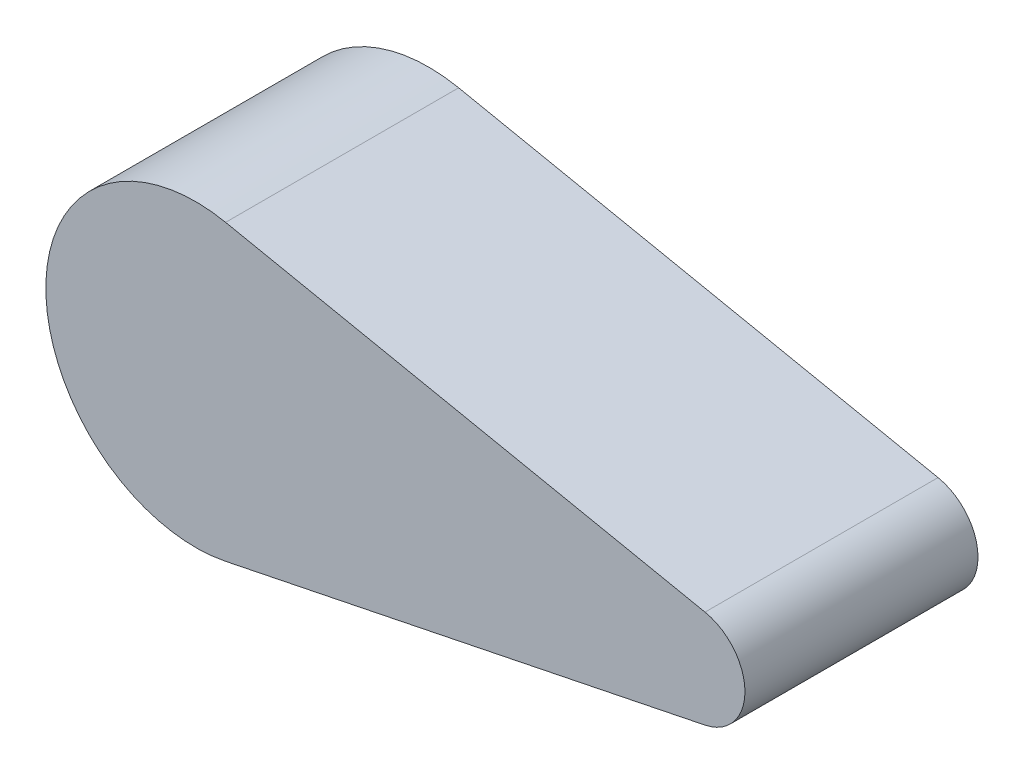
from build123d import *

# Parameters (mm, degrees)
BOSS_EXTRUDE1_DEPTH = 7
CUT_EXTRUDE1_DEPTH  = 5


with BuildPart() as part:
    # Sketch1 → Boss-Extrude1 (new body)
    with BuildSketch(Plane.XY):
        with BuildLine():
            Line((0.9, 4.409081537), (15.3, 1.469693846))
            ThreePointArc((15.3, 1.469693846), (16.5, 0), (15.3, -1.469693846))
            Line((15.3, -1.469693846), (0.9, -4.409081537))
            ThreePointArc((0.9, -4.409081537), (-4.5, 0), (0.9, 4.409081537))
        make_face()
    extrude(amount=BOSS_EXTRUDE1_DEPTH)

    # Sketch2 → Cut-Extrude1 (cut)
    with BuildSketch(Plane(origin=(0, 0, 0), x_dir=(-1, 0, 0), z_dir=(0, 0, -1))):
        with BuildLine():
            Line((0.323621049, -2.33034215), (0.285861652, -2.067133858))
            ThreePointArc((0.285861652, -2.067133858), (0.324400737, -1.894344075), (0.46770846, -1.790400808))
            add(Edge.make_bspline(
                [(0.46770846, -1.790400808), (0.507644834, -1.7795375), (0.54705519, -1.766898324)],
                knots=[1.762455787, 1.762455787, 1.762455787, 1.807210933, 1.807210933, 1.807210933], degree=2, weights=[1, 0.999749633, 1]))
            ThreePointArc((0.54705519, -1.766898324), (0.723856125, -1.776023385), (0.850282514, -1.899952525))
            Line((0.850282514, -1.899952525), (0.96196408, -2.141265087))
            add(Edge.make_bspline(
                [(0.96196408, -2.141265087), (0.965953537, -2.149885186), (0.971559773, -2.159792231), (0.982538977, -2.175431153), (0.999087228, -2.196781931), (1.018575452, -2.220978079), (1.038535601, -2.242722272), (1.065318491, -2.26943702), (1.093278731, -2.295479762), (1.122830329, -2.32056638), (1.163402531, -2.352492636), (1.211319166, -2.386601982), (1.265237405, -2.421286276), (1.34272265, -2.465791027), (1.417102533, -2.502156085), (1.477952577, -2.528307077), (1.525444105, -2.546734242), (1.558445397, -2.558649631)],
                knots=[0, 0, 0, 0, 0, 0, 0.071428571, 0.085714286, 0.142857143, 0.2, 0.228571429, 0.285714286, 0.357142857, 0.414285714, 0.471428571, 0.585714286, 0.685714286, 0.785714286, 1, 1, 1, 1, 1, 1], degree=5, weights=[1, 1, 1, 1, 1, 1, 1, 1, 1, 1, 1, 1, 1, 1, 1, 1, 1, 1]))
            add(Edge.make_bspline(
                [(1.558445397, -2.558649631), (1.683562718, -2.48139655), (1.800525234, -2.392277976)],
                knots=[2.05001656, 2.05001656, 2.05001656, 2.147968691, 2.147968691, 2.147968691], degree=2, weights=[1, 0.998800912, 1]))
            add(Edge.make_bspline(
                [(1.800525234, -2.392277976), (1.800853439, -2.375907689), (1.801128099, -2.345646078), (1.800622233, -2.301788837), (1.79817855, -2.244873034), (1.792497101, -2.17789772), (1.784749205, -2.116695575), (1.775086048, -2.058923592), (1.764076263, -2.006708452), (1.752833422, -1.961767192), (1.740585213, -1.91992906), (1.727716654, -1.880952589), (1.713496627, -1.843004378), (1.700109731, -1.811776165), (1.685169753, -1.779364956), (1.667272595, -1.746926056), (1.65207658, -1.722290783), (1.64211254, -1.705828498), (1.631252819, -1.692651969), (1.624635038, -1.68583821)],
                knots=[0, 0, 0, 0, 0, 0, 0.1, 0.185714286, 0.271428571, 0.357142857, 0.428571429, 0.5, 0.571428571, 0.628571429, 0.671428571, 0.728571429, 0.785714286, 0.857142857, 0.871428571, 0.928571429, 1, 1, 1, 1, 1, 1], degree=5, weights=[1, 1, 1, 1, 1, 1, 1, 1, 1, 1, 1, 1, 1, 1, 1, 1, 1, 1, 1, 1]))
            Line((1.624635038, -1.68583821), (1.439375721, -1.495092652))
            ThreePointArc((1.439375721, -1.495092652), (1.368990119, -1.332651294), (1.423832, -1.164325177))
            add(Edge.make_bspline(
                [(1.423832, -1.164325177), (1.449755888, -1.132062777), (1.47421038, -1.098672854)],
                knots=[2.390774318, 2.390774318, 2.390774318, 2.435529464, 2.435529464, 2.435529464], degree=2, weights=[1, 0.999749633, 1]))
            ThreePointArc((1.47421038, -1.098672854), (1.622610313, -1.002135669), (1.797734644, -1.02808486))
            Line((1.797734644, -1.02808486), (2.02992821, -1.157666433))
            add(Edge.make_bspline(
                [(2.02992821, -1.157666433), (2.038222563, -1.162295308), (2.048581373, -1.167015035), (2.066656151, -1.173213819), (2.092593762, -1.180760211), (2.122582343, -1.188880496), (2.151511485, -1.194739722), (2.188881989, -1.200609936), (2.226809993, -1.205244463), (2.265463432, -1.208170101), (2.317053009, -1.210151426), (2.375867562, -1.209581993), (2.439875467, -1.205950079), (2.52872187, -1.196410857), (2.610271546, -1.18211176), (2.674871613, -1.167501888), (2.724124412, -1.154495187), (2.757826794, -1.144737426)],
                knots=[0, 0, 0, 0, 0, 0, 0.071428571, 0.085714286, 0.142857143, 0.2, 0.228571429, 0.285714286, 0.357142857, 0.414285714, 0.471428571, 0.585714286, 0.685714286, 0.785714286, 1, 1, 1, 1, 1, 1], degree=5, weights=[1, 1, 1, 1, 1, 1, 1, 1, 1, 1, 1, 1, 1, 1, 1, 1, 1, 1]))
            add(Edge.make_bspline(
                [(2.757826794, -1.144737426), (2.813640313, -1.008696951), (2.855882026, -0.867850332)],
                knots=[2.678335091, 2.678335091, 2.678335091, 2.776287222, 2.776287222, 2.776287222], degree=2, weights=[1, 0.998800912, 1]))
            add(Edge.make_bspline(
                [(2.855882026, -0.867850332), (2.846525253, -0.854413592), (2.828959975, -0.829770018), (2.802771858, -0.794586136), (2.767340314, -0.749976675), (2.723376477, -0.699132002), (2.681134262, -0.654172532), (2.639358782, -0.613113872), (2.599760115, -0.577342309), (2.564248418, -0.547592419), (2.529747349, -0.520943945), (2.496426463, -0.496975231), (2.462616616, -0.474632762), (2.433430738, -0.457237183), (2.402293034, -0.43979741), (2.368746643, -0.424073408), (2.341972421, -0.413074989), (2.324234964, -0.405613397), (2.30770422, -0.4013365), (2.298345256, -0.399713859)],
                knots=[0, 0, 0, 0, 0, 0, 0.1, 0.185714286, 0.271428571, 0.357142857, 0.428571429, 0.5, 0.571428571, 0.628571429, 0.671428571, 0.728571429, 0.785714286, 0.857142857, 0.871428571, 0.928571429, 1, 1, 1, 1, 1, 1], degree=5, weights=[1, 1, 1, 1, 1, 1, 1, 1, 1, 1, 1, 1, 1, 1, 1, 1, 1, 1, 1, 1]))
            Line((2.298345256, -0.399713859), (2.036348781, -0.354289355))
            ThreePointArc((2.036348781, -0.354289355), (1.883923391, -0.264244715), (1.829351704, -0.095829389))
            add(Edge.make_bspline(
                [(1.829351704, -0.095829389), (1.831361062, -0.054491036), (1.831518905, -0.013104181)],
                knots=[3.019092849, 3.019092849, 3.019092849, 3.063847995, 3.063847995, 3.063847995], degree=2, weights=[1, 0.999749633, 1]))
            ThreePointArc((1.831518905, -0.013104181), (1.894835174, 0.152221905), (2.051764837, 0.234163792))
            Line((2.051764837, 0.234163792), (2.315780353, 0.265808966))
            add(Edge.make_bspline(
                [(2.315780353, 0.265808966), (2.325211439, 0.266939386), (2.33636611, 0.269209754), (2.354632512, 0.274818833), (2.380052196, 0.283959292), (2.409086516, 0.295016542), (2.435934702, 0.307280309), (2.469618558, 0.324496851), (2.503027117, 0.343040771), (2.536018098, 0.363393607), (2.578919584, 0.392114012), (2.626166896, 0.42714472), (2.675815623, 0.467705573), (2.742086877, 0.527645111), (2.799657142, 0.587146594), (2.843332201, 0.636936854), (2.875533377, 0.676409304), (2.897063684, 0.704113083)],
                knots=[0, 0, 0, 0, 0, 0, 0.071428571, 0.085714286, 0.142857143, 0.2, 0.228571429, 0.285714286, 0.357142857, 0.414285714, 0.471428571, 0.585714286, 0.685714286, 0.785714286, 1, 1, 1, 1, 1, 1], degree=5, weights=[1, 1, 1, 1, 1, 1, 1, 1, 1, 1, 1, 1, 1, 1, 1, 1, 1, 1]))
            add(Edge.make_bspline(
                [(2.897063684, 0.704113083), (2.862254533, 0.846978114), (2.813640546, 0.985754156)],
                knots=[0.165060968, 0.165060968, 0.165060968, 0.263013099, 0.263013099, 0.263013099], degree=2, weights=[1, 0.998800912, 1]))
            add(Edge.make_bspline(
                [(2.813640546, 0.985754156), (2.798172764, 0.991124972), (2.769476887, 1.000737501), (2.727609489, 1.013808977), (2.67272373, 1.029072797), (2.607270197, 1.044365893), (2.546668752, 1.055909698), (2.488737763, 1.064572022), (2.435675559, 1.070236487), (2.389459267, 1.07343156), (2.345883574, 1.074711565), (2.304837807, 1.074517288), (2.264352353, 1.072719952), (2.230515505, 1.069638378), (2.19507362, 1.065445312), (2.158691577, 1.058448382), (2.130565992, 1.051608926), (2.111830223, 1.047219749), (2.095942638, 1.040963386), (2.087417297, 1.036775116)],
                knots=[0, 0, 0, 0, 0, 0, 0.1, 0.185714286, 0.271428571, 0.357142857, 0.428571429, 0.5, 0.571428571, 0.628571429, 0.671428571, 0.728571429, 0.785714286, 0.857142857, 0.871428571, 0.928571429, 1, 1, 1, 1, 1, 1], degree=5, weights=[1, 1, 1, 1, 1, 1, 1, 1, 1, 1, 1, 1, 1, 1, 1, 1, 1, 1, 1, 1]))
            Line((2.087417297, 1.036775116), (1.848757412, 0.919527948))
            ThreePointArc((1.848757412, 0.919527948), (1.672514713, 0.902782245), (1.529372827, 1.006957484))
            add(Edge.make_bspline(
                [(1.529372827, 1.006957484), (1.506700148, 1.041581943), (1.482501053, 1.075157357)],
                knots=[3.647411379, 3.647411379, 3.647411379, 3.692166525, 3.692166525, 3.692166525], degree=2, weights=[1, 0.999749633, 1]))
            ThreePointArc((1.482501053, 1.075157357), (1.436548113, 1.246124238), (1.515342192, 1.40465735))
            Line((1.515342192, 1.40465735), (1.710334704, 1.585441889))
            add(Edge.make_bspline(
                [(1.710334704, 1.585441889), (1.717300171, 1.591899823), (1.724989997, 1.600293081), (1.736470878, 1.615567546), (1.75166318, 1.637903511), (1.768653115, 1.663914804), (1.783165251, 1.689617221), (1.800296371, 1.723344385), (1.816424551, 1.757983605), (1.831151639, 1.793840823), (1.848978127, 1.84229274), (1.866611328, 1.898404183), (1.882936752, 1.960401108), (1.901319491, 2.047846095), (1.91292046, 2.129822419), (1.918988124, 2.195774881), (1.921837921, 2.246635946), (1.922972308, 2.28170384)],
                knots=[0, 0, 0, 0, 0, 0, 0.071428571, 0.085714286, 0.142857143, 0.2, 0.228571429, 0.285714286, 0.357142857, 0.414285714, 0.471428571, 0.585714286, 0.685714286, 0.785714286, 1, 1, 1, 1, 1, 1], degree=5, weights=[1, 1, 1, 1, 1, 1, 1, 1, 1, 1, 1, 1, 1, 1, 1, 1, 1, 1]))
            add(Edge.make_bspline(
                [(1.922972308, 2.28170384), (1.8108364, 2.376823842), (1.689935602, 2.460521576)],
                knots=[0.793379498, 0.793379498, 0.793379498, 0.89133163, 0.89133163, 0.89133163], degree=2, weights=[1, 0.998800912, 1]))
            add(Edge.make_bspline(
                [(1.689935602, 2.460521576), (1.674264978, 2.455774998), (1.645399352, 2.446684823), (1.603844596, 2.432651034), (1.550469117, 2.412738952), (1.488526913, 2.386639027), (1.432713931, 2.360357826), (1.380755102, 2.333315102), (1.334497318, 2.306708836), (1.295229484, 2.282128683), (1.259223601, 2.2575513), (1.22613104, 2.23326824), (1.194434046, 2.208017619), (1.168870755, 2.185635948), (1.142662284, 2.161411653), (1.117341293, 2.134366381), (1.098607362, 2.112301489), (1.086029708, 2.09773806), (1.0768538, 2.083338153), (1.072418473, 2.074938749)],
                knots=[0, 0, 0, 0, 0, 0, 0.1, 0.185714286, 0.271428571, 0.357142857, 0.428571429, 0.5, 0.571428571, 0.628571429, 0.671428571, 0.728571429, 0.785714286, 0.857142857, 0.871428571, 0.928571429, 1, 1, 1, 1, 1, 1], degree=5, weights=[1, 1, 1, 1, 1, 1, 1, 1, 1, 1, 1, 1, 1, 1, 1, 1, 1, 1, 1, 1]))
            Line((1.072418473, 2.074938749), (0.948255143, 1.839804344))
            ThreePointArc((0.948255143, 1.839804344), (0.815513146, 1.722665577), (0.638477105, 1.722808337))
            add(Edge.make_bspline(
                [(0.638477105, 1.722808337), (0.599782583, 1.737493536), (0.56046978, 1.750432844)],
                knots=[4.27572991, 4.27572991, 4.27572991, 4.320485056, 4.320485056, 4.320485056], degree=2, weights=[1, 0.999749633, 1]))
            ThreePointArc((0.56046978, 1.750432844), (0.422799569, 1.861735884), (0.393361928, 2.036307057))
            Line((0.393361928, 2.036307057), (0.444850924, 2.297177412))
            add(Edge.make_bspline(
                [(0.444850924, 2.297177412), (0.446690199, 2.306496149), (0.447977929, 2.317806358), (0.448287982, 2.336911882), (0.447449959, 2.363911774), (0.445905932, 2.394941679), (0.442538874, 2.424265297), (0.436573753, 2.461620452), (0.429261137, 2.499123968), (0.420099087, 2.53678933), (0.406041462, 2.586465772), (0.38732527, 2.642225286), (0.364091634, 2.701977566), (0.327564276, 2.783526989), (0.288764773, 2.856665985), (0.2549074, 2.91358905), (0.227317293, 2.956411532), (0.207622463, 2.985448798)],
                knots=[0, 0, 0, 0, 0, 0, 0.071428571, 0.085714286, 0.142857143, 0.2, 0.228571429, 0.285714286, 0.357142857, 0.414285714, 0.471428571, 0.585714286, 0.685714286, 0.785714286, 1, 1, 1, 1, 1, 1], degree=5, weights=[1, 1, 1, 1, 1, 1, 1, 1, 1, 1, 1, 1, 1, 1, 1, 1, 1, 1]))
            add(Edge.make_bspline(
                [(0.207622463, 2.985448798), (0.060991903, 2.996491162), (-0.086015709, 2.993140898)],
                knots=[4.563290683, 4.563290683, 4.563290683, 4.661242814, 4.661242814, 4.661242814], degree=2, weights=[1, 0.998800912, 1]))
            add(Edge.make_bspline(
                [(-0.086015709, 2.993140898), (-0.09590353, 2.980089958), (-0.113913217, 2.955769217), (-0.139282826, 2.919990593), (-0.170760407, 2.872508348), (-0.205531466, 2.814984687), (-0.235237323, 2.760917006), (-0.261377486, 2.708498634), (-0.283161947, 2.659784326), (-0.300482345, 2.61681773), (-0.315165395, 2.575770684), (-0.327664516, 2.536674144), (-0.338465875, 2.497615118), (-0.345991301, 2.464482388), (-0.352955613, 2.429479721), (-0.357543794, 2.392716481), (-0.359730346, 2.363854192), (-0.361345649, 2.344679246), (-0.360304995, 2.327636071), (-0.358956165, 2.31823382)],
                knots=[0, 0, 0, 0, 0, 0, 0.1, 0.185714286, 0.271428571, 0.357142857, 0.428571429, 0.5, 0.571428571, 0.628571429, 0.671428571, 0.728571429, 0.785714286, 0.857142857, 0.871428571, 0.928571429, 1, 1, 1, 1, 1, 1], degree=5, weights=[1, 1, 1, 1, 1, 1, 1, 1, 1, 1, 1, 1, 1, 1, 1, 1, 1, 1, 1, 1]))
            Line((-0.358956165, 2.31823382), (-0.321196768, 2.055025527))
            ThreePointArc((-0.321196768, 2.055025527), (-0.359735853, 1.882235744), (-0.503043576, 1.778292477))
            add(Edge.make_bspline(
                [(-0.503043576, 1.778292477), (-0.54297995, 1.767429169), (-0.582390306, 1.754789993)],
                knots=[4.904048441, 4.904048441, 4.904048441, 4.948803587, 4.948803587, 4.948803587], degree=2, weights=[1, 0.999749633, 1]))
            ThreePointArc((-0.582390306, 1.754789993), (-0.759191241, 1.763915054), (-0.88561763, 1.887844194))
            Line((-0.88561763, 1.887844194), (-0.997299196, 2.129156756))
            add(Edge.make_bspline(
                [(-0.997299196, 2.129156756), (-1.001288653, 2.137776855), (-1.006894889, 2.1476839), (-1.017874093, 2.163322822), (-1.034422344, 2.1846736), (-1.053910568, 2.208869748), (-1.073870717, 2.230613942), (-1.100653607, 2.257328689), (-1.128613847, 2.283371431), (-1.158165445, 2.308458049), (-1.198737647, 2.340384305), (-1.246654283, 2.374493651), (-1.300572521, 2.409177945), (-1.378057766, 2.453682696), (-1.452437649, 2.490047754), (-1.513287693, 2.516198746), (-1.560779221, 2.534625911), (-1.593780513, 2.546541301)],
                knots=[0, 0, 0, 0, 0, 0, 0.071428571, 0.085714286, 0.142857143, 0.2, 0.228571429, 0.285714286, 0.357142857, 0.414285714, 0.471428571, 0.585714286, 0.685714286, 0.785714286, 1, 1, 1, 1, 1, 1], degree=5, weights=[1, 1, 1, 1, 1, 1, 1, 1, 1, 1, 1, 1, 1, 1, 1, 1, 1, 1]))
            add(Edge.make_bspline(
                [(-1.593780513, 2.546541301), (-1.718897834, 2.46928822), (-1.83586035, 2.380169645)],
                knots=[2.05001656, 2.05001656, 2.05001656, 2.147968691, 2.147968691, 2.147968691], degree=2, weights=[1, 0.998800912, 1]))
            add(Edge.make_bspline(
                [(-1.83586035, 2.380169645), (-1.836188555, 2.363799358), (-1.836463215, 2.333537748), (-1.835957349, 2.289680507), (-1.833513666, 2.232764703), (-1.827832217, 2.165789389), (-1.820084321, 2.104587244), (-1.810421164, 2.046815261), (-1.799411379, 1.994600121), (-1.788168538, 1.949658861), (-1.775920329, 1.907820729), (-1.76305177, 1.868844258), (-1.748831743, 1.830896047), (-1.735444847, 1.799667834), (-1.720504869, 1.767256625), (-1.702607711, 1.734817725), (-1.687411696, 1.710182452), (-1.677447657, 1.693720167), (-1.666587935, 1.680543638), (-1.659970155, 1.673729879)],
                knots=[0, 0, 0, 0, 0, 0, 0.1, 0.185714286, 0.271428571, 0.357142857, 0.428571429, 0.5, 0.571428571, 0.628571429, 0.671428571, 0.728571429, 0.785714286, 0.857142857, 0.871428571, 0.928571429, 1, 1, 1, 1, 1, 1], degree=5, weights=[1, 1, 1, 1, 1, 1, 1, 1, 1, 1, 1, 1, 1, 1, 1, 1, 1, 1, 1, 1]))
            Line((-1.659970155, 1.673729879), (-1.474710837, 1.482984321))
            ThreePointArc((-1.474710837, 1.482984321), (-1.404325235, 1.320542963), (-1.459167116, 1.152216847))
            add(Edge.make_bspline(
                [(-1.459167116, 1.152216847), (-1.485091004, 1.119954446), (-1.509545496, 1.086564523)],
                knots=[5.532366971, 5.532366971, 5.532366971, 5.577122117, 5.577122117, 5.577122117], degree=2, weights=[1, 0.999749633, 1]))
            ThreePointArc((-1.509545496, 1.086564523), (-1.657945429, 0.990027339), (-1.83306976, 1.015976529))
            Line((-1.83306976, 1.015976529), (-2.065263327, 1.145558102))
            add(Edge.make_bspline(
                [(-2.065263327, 1.145558102), (-2.073557679, 1.150186978), (-2.083916489, 1.154906704), (-2.101991267, 1.161105488), (-2.127928878, 1.16865188), (-2.157917459, 1.176772165), (-2.186846601, 1.182631391), (-2.224217105, 1.188501605), (-2.262145109, 1.193136132), (-2.300798548, 1.19606177), (-2.352388125, 1.198043095), (-2.411202678, 1.197473662), (-2.475210583, 1.193841748), (-2.564056986, 1.184302526), (-2.645606662, 1.170003429), (-2.710206729, 1.155393558), (-2.759459528, 1.142386856), (-2.79316191, 1.132629095)],
                knots=[0, 0, 0, 0, 0, 0, 0.071428571, 0.085714286, 0.142857143, 0.2, 0.228571429, 0.285714286, 0.357142857, 0.414285714, 0.471428571, 0.585714286, 0.685714286, 0.785714286, 1, 1, 1, 1, 1, 1], degree=5, weights=[1, 1, 1, 1, 1, 1, 1, 1, 1, 1, 1, 1, 1, 1, 1, 1, 1, 1]))
            add(Edge.make_bspline(
                [(-2.79316191, 1.132629095), (-2.848975429, 0.99658862), (-2.891217143, 0.855742001)],
                knots=[5.819927744, 5.819927744, 5.819927744, 5.917879875, 5.917879875, 5.917879875], degree=2, weights=[1, 0.998800912, 1]))
            add(Edge.make_bspline(
                [(-2.891217143, 0.855742001), (-2.88186037, 0.842305261), (-2.864295092, 0.817661687), (-2.838106974, 0.782477805), (-2.80267543, 0.737868344), (-2.758711593, 0.687023671), (-2.716469378, 0.642064201), (-2.674693898, 0.601005542), (-2.635095231, 0.565233978), (-2.599583534, 0.535484088), (-2.565082465, 0.508835614), (-2.531761579, 0.4848669), (-2.497951732, 0.462524431), (-2.468765854, 0.445128852), (-2.43762815, 0.427689079), (-2.404081759, 0.411965077), (-2.377307537, 0.400966658), (-2.35957008, 0.393505067), (-2.343039336, 0.389228169), (-2.333680372, 0.387605528)],
                knots=[0, 0, 0, 0, 0, 0, 0.1, 0.185714286, 0.271428571, 0.357142857, 0.428571429, 0.5, 0.571428571, 0.628571429, 0.671428571, 0.728571429, 0.785714286, 0.857142857, 0.871428571, 0.928571429, 1, 1, 1, 1, 1, 1], degree=5, weights=[1, 1, 1, 1, 1, 1, 1, 1, 1, 1, 1, 1, 1, 1, 1, 1, 1, 1, 1, 1]))
            Line((-2.333680372, 0.387605528), (-2.071683897, 0.342181024))
            ThreePointArc((-2.071683897, 0.342181024), (-1.919258507, 0.252136385), (-1.86468682, 0.083721058))
            add(Edge.make_bspline(
                [(-1.86468682, 0.083721058), (-1.866696178, 0.042382705), (-1.866854021, 0.000995851)],
                knots=[6.160685502, 6.160685502, 6.160685502, 6.205440648, 6.205440648, 6.205440648], degree=2, weights=[1, 0.999749633, 1]))
            ThreePointArc((-1.866854021, 0.000995851), (-1.93017029, -0.164330236), (-2.087099953, -0.246272123))
            Line((-2.087099953, -0.246272123), (-2.351115469, -0.277917297))
            add(Edge.make_bspline(
                [(-2.351115469, -0.277917297), (-2.360546556, -0.279047717), (-2.371701226, -0.281318085), (-2.389967628, -0.286927164), (-2.415387312, -0.296067623), (-2.444421633, -0.307124873), (-2.471269818, -0.31938864), (-2.504953674, -0.336605182), (-2.538362233, -0.355149102), (-2.571353214, -0.375501938), (-2.614254701, -0.404222343), (-2.661502012, -0.439253051), (-2.711150739, -0.479813904), (-2.777421993, -0.539753442), (-2.834992258, -0.599254925), (-2.878667318, -0.649045185), (-2.910868493, -0.688517635), (-2.932398801, -0.716221414)],
                knots=[0, 0, 0, 0, 0, 0, 0.071428571, 0.085714286, 0.142857143, 0.2, 0.228571429, 0.285714286, 0.357142857, 0.414285714, 0.471428571, 0.585714286, 0.685714286, 0.785714286, 1, 1, 1, 1, 1, 1], degree=5, weights=[1, 1, 1, 1, 1, 1, 1, 1, 1, 1, 1, 1, 1, 1, 1, 1, 1, 1]))
            add(Edge.make_bspline(
                [(-2.932398801, -0.716221414), (-2.897589649, -0.859086445), (-2.848975662, -0.997862487)],
                knots=[3.306653621, 3.306653621, 3.306653621, 3.404605753, 3.404605753, 3.404605753], degree=2, weights=[1, 0.998800912, 1]))
            add(Edge.make_bspline(
                [(-2.848975662, -0.997862487), (-2.83350788, -1.003233303), (-2.804812003, -1.012845832), (-2.762944605, -1.025917308), (-2.708058846, -1.041181128), (-2.642605313, -1.056474223), (-2.582003868, -1.068018028), (-2.52407288, -1.076680353), (-2.471010675, -1.082344818), (-2.424794383, -1.085539891), (-2.38121869, -1.086819896), (-2.340172923, -1.086625619), (-2.299687469, -1.084828282), (-2.265850621, -1.081746708), (-2.230408736, -1.077553643), (-2.194026693, -1.070556713), (-2.165901108, -1.063717257), (-2.147165339, -1.05932808), (-2.131277754, -1.053071716), (-2.122752413, -1.048883446)],
                knots=[0, 0, 0, 0, 0, 0, 0.1, 0.185714286, 0.271428571, 0.357142857, 0.428571429, 0.5, 0.571428571, 0.628571429, 0.671428571, 0.728571429, 0.785714286, 0.857142857, 0.871428571, 0.928571429, 1, 1, 1, 1, 1, 1], degree=5, weights=[1, 1, 1, 1, 1, 1, 1, 1, 1, 1, 1, 1, 1, 1, 1, 1, 1, 1, 1, 1]))
            Line((-2.122752413, -1.048883446), (-1.884092528, -0.931636279))
            ThreePointArc((-1.884092528, -0.931636279), (-1.707849829, -0.914890576), (-1.564707943, -1.019065815))
            add(Edge.make_bspline(
                [(-1.564707943, -1.019065815), (-1.542035264, -1.053690274), (-1.517836169, -1.087265688)],
                knots=[0.505818726, 0.505818726, 0.505818726, 0.550573872, 0.550573872, 0.550573872], degree=2, weights=[1, 0.999749633, 1]))
            ThreePointArc((-1.517836169, -1.087265688), (-1.47188323, -1.258232569), (-1.550677308, -1.416765681))
            Line((-1.550677308, -1.416765681), (-1.74566982, -1.59755022))
            add(Edge.make_bspline(
                [(-1.74566982, -1.59755022), (-1.752635287, -1.604008154), (-1.760325113, -1.612401412), (-1.771805994, -1.627675877), (-1.786998296, -1.650011842), (-1.803988232, -1.676023134), (-1.818500367, -1.701725551), (-1.835631487, -1.735452716), (-1.851759667, -1.770091936), (-1.866486755, -1.805949154), (-1.884313243, -1.854401071), (-1.901946444, -1.910512513), (-1.918271868, -1.972509439), (-1.936654607, -2.059954426), (-1.948255576, -2.14193075), (-1.95432324, -2.207883212), (-1.957173037, -2.258744277), (-1.958307424, -2.293812171)],
                knots=[0, 0, 0, 0, 0, 0, 0.071428571, 0.085714286, 0.142857143, 0.2, 0.228571429, 0.285714286, 0.357142857, 0.414285714, 0.471428571, 0.585714286, 0.685714286, 0.785714286, 1, 1, 1, 1, 1, 1], degree=5, weights=[1, 1, 1, 1, 1, 1, 1, 1, 1, 1, 1, 1, 1, 1, 1, 1, 1, 1]))
            add(Edge.make_bspline(
                [(-1.958307424, -2.293812171), (-1.846171516, -2.388932173), (-1.725270718, -2.472629907)],
                knots=[0.793379498, 0.793379498, 0.793379498, 0.89133163, 0.89133163, 0.89133163], degree=2, weights=[1, 0.998800912, 1]))
            add(Edge.make_bspline(
                [(-1.725270718, -2.472629907), (-1.709600094, -2.467883329), (-1.680734468, -2.458793154), (-1.639179712, -2.444759365), (-1.585804233, -2.424847283), (-1.523862029, -2.398747358), (-1.468049047, -2.372466157), (-1.416090218, -2.345423433), (-1.369832434, -2.318817167), (-1.330564601, -2.294237013), (-1.294558717, -2.269659631), (-1.261466156, -2.24537657), (-1.229769162, -2.22012595), (-1.204205871, -2.197744279), (-1.1779974, -2.173519984), (-1.15267641, -2.146474712), (-1.133942478, -2.124409819), (-1.121364824, -2.109846391), (-1.112188916, -2.095446484), (-1.107753589, -2.08704708)],
                knots=[0, 0, 0, 0, 0, 0, 0.1, 0.185714286, 0.271428571, 0.357142857, 0.428571429, 0.5, 0.571428571, 0.628571429, 0.671428571, 0.728571429, 0.785714286, 0.857142857, 0.871428571, 0.928571429, 1, 1, 1, 1, 1, 1], degree=5, weights=[1, 1, 1, 1, 1, 1, 1, 1, 1, 1, 1, 1, 1, 1, 1, 1, 1, 1, 1, 1]))
            Line((-1.107753589, -2.08704708), (-0.983590259, -1.851912675))
            ThreePointArc((-0.983590259, -1.851912675), (-0.850848262, -1.734773907), (-0.673812221, -1.734916668))
            add(Edge.make_bspline(
                [(-0.673812221, -1.734916668), (-0.635117699, -1.749601867), (-0.595804896, -1.762541174)],
                knots=[1.134137256, 1.134137256, 1.134137256, 1.178892402, 1.178892402, 1.178892402], degree=2, weights=[1, 0.999749633, 1]))
            ThreePointArc((-0.595804896, -1.762541174), (-0.458134685, -1.873844215), (-0.428697044, -2.048415388))
            Line((-0.428697044, -2.048415388), (-0.48018604, -2.309285743))
            add(Edge.make_bspline(
                [(-0.48018604, -2.309285743), (-0.482025315, -2.318604479), (-0.483313045, -2.329914689), (-0.483623098, -2.349020212), (-0.482785076, -2.376020105), (-0.481241048, -2.40705001), (-0.47787399, -2.436373627), (-0.471908869, -2.473728783), (-0.464596254, -2.511232298), (-0.455434203, -2.54889766), (-0.441376578, -2.598574103), (-0.422660386, -2.654333617), (-0.39942675, -2.714085897), (-0.362899392, -2.79563532), (-0.324099889, -2.868774316), (-0.290242516, -2.925697381), (-0.262652409, -2.968519862), (-0.242957579, -2.997557129)],
                knots=[0, 0, 0, 0, 0, 0, 0.071428571, 0.085714286, 0.142857143, 0.2, 0.228571429, 0.285714286, 0.357142857, 0.414285714, 0.471428571, 0.585714286, 0.685714286, 0.785714286, 1, 1, 1, 1, 1, 1], degree=5, weights=[1, 1, 1, 1, 1, 1, 1, 1, 1, 1, 1, 1, 1, 1, 1, 1, 1, 1]))
            add(Edge.make_bspline(
                [(-0.242957579, -2.997557129), (-0.096327019, -3.008599493), (0.050680593, -3.005249229)],
                knots=[1.421698029, 1.421698029, 1.421698029, 1.51965016, 1.51965016, 1.51965016], degree=2, weights=[1, 0.998800912, 1]))
            add(Edge.make_bspline(
                [(0.050680593, -3.005249229), (0.060568414, -2.992198289), (0.078578101, -2.967877548), (0.10394771, -2.932098924), (0.135425291, -2.884616679), (0.170196349, -2.827093018), (0.199902207, -2.773025337), (0.22604237, -2.720606965), (0.247826831, -2.671892657), (0.265147229, -2.62892606), (0.279830279, -2.587879015), (0.2923294, -2.548782475), (0.303130759, -2.509723449), (0.310656185, -2.476590718), (0.317620497, -2.441588052), (0.322208678, -2.404824812), (0.32439523, -2.375962522), (0.326010533, -2.356787577), (0.324969879, -2.339744402), (0.323621049, -2.33034215)],
                knots=[0, 0, 0, 0, 0, 0, 0.1, 0.185714286, 0.271428571, 0.357142857, 0.428571429, 0.5, 0.571428571, 0.628571429, 0.671428571, 0.728571429, 0.785714286, 0.857142857, 0.871428571, 0.928571429, 1, 1, 1, 1, 1, 1], degree=5, weights=[1, 1, 1, 1, 1, 1, 1, 1, 1, 1, 1, 1, 1, 1, 1, 1, 1, 1, 1, 1]))
        make_face()
    extrude(amount=-CUT_EXTRUDE1_DEPTH, mode=Mode.SUBTRACT)


solid = part.part
